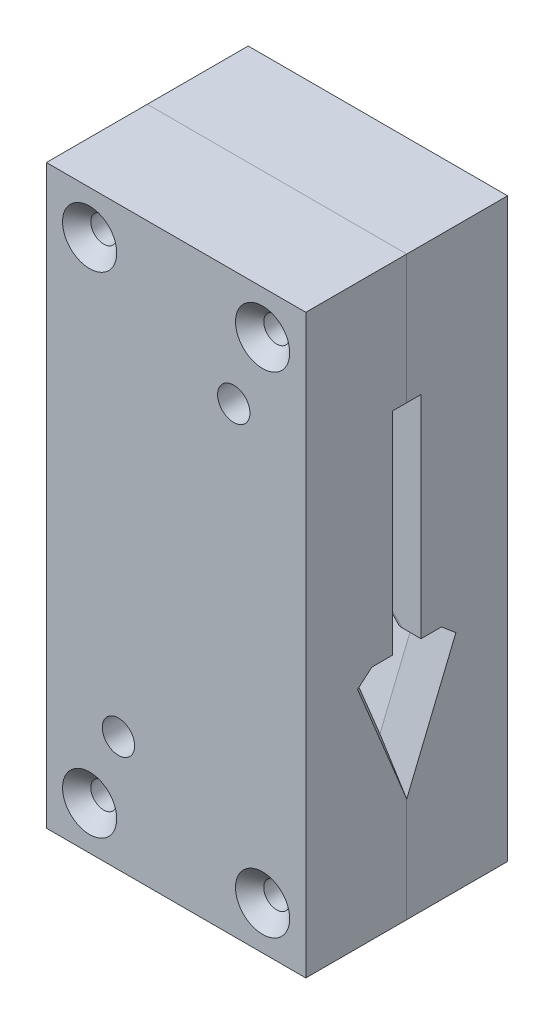
from build123d import *
from OCP.BRepFilletAPI import BRepFilletAPI_MakeChamfer

# Parameters (mm, degrees)
BOSS_V_BLADE_PROFILE_DEPTH                     = 150
CUT_BLADE_TIP_CHAMFER_DEPTH                    = 158.368393375
CUT_BLADE_TIP_CHAMFER_DEPTH_BACK               = 158.368393375
CHAMFER1_SIZE                                  = 1.8
CHAMFER1_SIZE2                                 = 5
FILLET1_R                                      = 15
SKETCH5_W                                      = 45
SKETCH5_H                                      = 100
BOSS_EXTRUDE_MAIN_BODY_DEPTH                   = 17.5
SKETCH7_W                                      = 45
SKETCH7_H                                      = 100
CUT_EXTRUDE_SPLIT_HALF_DEPTH                   = 93.589723794
CUT_EXTRUDE13_TRIANGLE_REACH                   = 90.86
CUT_EXTRUDE15_COMPLETE_ARROW_WITH_DRAFT_REACH  = 90.86
SKETCH23_R                                     = 2.8067
CUT_EXTRUDE12_THREADED_INSERTS_DEPTH           = 10
CHAMFER4_SIZE                                  = 5
CHAMFER4_SIZE2                                 = 1
FILLET2_R                                      = 1
SPLIT1_SURFACE_1_BACK                          = 116.109
SPLIT1_SURFACE_1_DEPTH                         = 232.218
SPLIT1_SURFACE_2_BACK                          = 116.109
SPLIT1_SURFACE_2_DEPTH                         = 232.218
CSK_FOR_M4_FLAT_HEAD_MACHINE_SCREW1_AT_2_COUNT = 2
CSK_FOR_M4_FLAT_HEAD_MACHINE_SCREW1_AT_2_PITCH = 30
CSK_FOR_M4_FLAT_HEAD_MACHINE_SCREW1_AT_3_COUNT = 2
CSK_FOR_M4_FLAT_HEAD_MACHINE_SCREW1_AT_3_PITCH = 85
CSK_FOR_M4_FLAT_HEAD_MACHINE_SCREW1_AT_4_COUNT = 2
CSK_FOR_M4_FLAT_HEAD_MACHINE_SCREW1_AT_4_PITCH = 90.138781887
F_1_0MM_START                                  = -17.5
F_1_0MM_DOWEL_HOLE1_OUTLINE_R                  = 2.807
F_1_0MM_DOWEL_HOLE1_DEPTH                      = 17.501


# Read off the part's stored shape, not the designer's step: Ø1.0mm Dowel Hole1
with BuildPart() as part:
    # Sketch3 → Boss-v blade profile (new body)
    with BuildSketch(Plane(origin=(0, 0, 0), x_dir=(0.7193398003386497, 0.6946583704589988, 0), z_dir=(0.6946583704589988, -0.7193398003386497, 0))):
        Polygon((13.036284021, -7.725), (0, 0), (13.036284021, 7.725), (14.030379125, 6.04741992), (3.82508674, 0), (14.030379125, -6.04741992), align=None)
    extrude(amount=BOSS_V_BLADE_PROFILE_DEPTH)

    # Sketch4 → Cut-blade tip chamfer (cut, two sides: drawn at the far end of the back side and taken through both)
    with BuildSketch(Plane.XY.offset(-CUT_BLADE_TIP_CHAMFER_DEPTH_BACK)):
        Polygon((10.092610118, 9.7463203), (0, 0), (2.611518653, -2.704306731), align=None)
    extrude(amount=CUT_BLADE_TIP_CHAMFER_DEPTH + CUT_BLADE_TIP_CHAMFER_DEPTH_BACK, mode=Mode.SUBTRACT)

    # Chamfer1
    chamfer1_edges = [part.edges().sort_by_distance(p)[0] for p in [
        (6.087035325, 3.079924357, -3.8625),
        (6.087035325, 3.079924357, 3.8625),
    ]]
    chamfer1_side = [part.faces().sort_by_distance(p)[0] for p in [
        (6.141291032, 3.170221016, -3.678457706),
    ]]
    chamfer(chamfer1_edges, length=CHAMFER1_SIZE, length2=CHAMFER1_SIZE2, reference=chamfer1_side[0])

    # Fillet1
    # the kernel refuses this fillet: 15 mm, written as the material it takes off along each edge
    with BuildSketch(Plane(origin=(128.043138255, -84.874717349, 26.213735463), x_dir=(-0.6188462152488227, -0.5976128433976327, 0.5097923609455172), z_dir=(-0.3667139351367172, -0.3541315307268587, -0.8602974768773856)), Plane(origin=(99.824500946, -112.125138638, 39.986155383), x_dir=(-0.6188462152488224, -0.5976128433976324, -0.5097923609455178), z_dir=(0.3667139351367176, 0.3541315307268591, -0.8602974768773851))) as fillet1_piece_1:
        with BuildLine():
            CenterArc((FILLET1_R, FILLET1_R), FILLET1_R, 180, 90)
            Line((0, FILLET1_R), (0, 0))
            Line((0, 0), (FILLET1_R, 0))
        make_face()
    extrude(amount=76.95, mode=Mode.SUBTRACT)


with BuildPart() as body_2:
    # Sketch5 → Boss-Extrude-main body (new, symmetric)
    with BuildSketch(Plane.XY):
        with Locations((29.477731109, -24.598407631)):
            Rectangle(SKETCH5_W, SKETCH5_H)
    extrude(amount=BOSS_EXTRUDE_MAIN_BODY_DEPTH, both=True)

    # Combine1: cut part
    add(part.part, mode=Mode.SUBTRACT)

    # Sketch7 → Cut-Extrude-split half (cut, through all)
    with BuildSketch(Plane.XY):
        with Locations((29.477731109, -24.598407631)):
            Rectangle(SKETCH7_W, SKETCH7_H)
    extrude(amount=-CUT_EXTRUDE_SPLIT_HALF_DEPTH, mode=Mode.SUBTRACT)

    # Sketch24 → Cut-Extrude13-triangle (cut, up to next)
    with BuildSketch(Plane(origin=(51.977731109, 0, 0), x_dir=(0, 0, -1), z_dir=(1, 0, 0)), mode=Mode.PRIVATE) as cut_extrude13_triangle_sk1:
        Polygon((-6.04741992, -33.626992184), (0, -33.626992184), (0, -48.318087575), align=None)
    cut_extrude13_triangle_tool1 = extrude(cut_extrude13_triangle_sk1.sketch, amount=-CUT_EXTRUDE13_TRIANGLE_REACH, mode=Mode.PRIVATE) & body_2.part
    add(cut_extrude13_triangle_tool1.solids().sort_by_distance((51.977731, -38.524024, 2.015807))[0], mode=Mode.SUBTRACT)

    # Cut-Extrude15-complete arrow with draft: up to this plane
    cut_extrude15_complete_arrow_with_draft_end = Plane(origin=(106.950292701, -105.243841529, 0), z_dir=(-0.36671393513671685, -0.3541315307268584, 0.8602974768773857))
    # Sketch25 → Cut-Extrude15-complete arrow with draft (cut, up to the surface)
    with BuildSketch(Plane(origin=(51.977731109, 0, 0), x_dir=(0, 0, -1), z_dir=(1, 0, 0)), mode=Mode.PRIVATE) as cut_extrude15_complete_arrow_with_draft_sk1:
        Polygon((-2.484190366, 3.062291075), (-2.484190366, -33.626992184), (-0.561386507, -33.626992184), (0, -33.626992184), (0, 3.062291075), align=None)
    cut_extrude15_complete_arrow_with_draft_tool1 = split(extrude(cut_extrude15_complete_arrow_with_draft_sk1.sketch, amount=-CUT_EXTRUDE15_COMPLETE_ARROW_WITH_DRAFT_REACH, mode=Mode.PRIVATE), bisect_by=cut_extrude15_complete_arrow_with_draft_end, keep=Keep.BOTH, mode=Mode.PRIVATE)
    add(cut_extrude15_complete_arrow_with_draft_tool1.solids().sort_by_distance((51.977731, -15.282351, 1.242095))[0], mode=Mode.SUBTRACT)

    # Sketch23 → Cut-Extrude12-threaded inserts (cut)
    with BuildSketch(Plane.XY.offset(17.5)):
        with Locations((39.477731109, 5.401592369)):
            Circle(SKETCH23_R)
        with Locations((19.477731109, -54.598407631)):
            Circle(SKETCH23_R)
    extrude(amount=-CUT_EXTRUDE12_THREADED_INSERTS_DEPTH, mode=Mode.SUBTRACT)

    # Mirror1: body 2 across plane


with BuildPart() as body_2_1:
    add(body_2.part)
    add(body_2.part.mirror(Plane.XY))

    # Chamfer4: one chamfer whose edges measure the first distance from different faces: ONE call of the kernel's chamfer builder (chamfer() names one face for all edges)
    chamfer4_edges_1 = [body_2_1.edges().sort_by_distance(p)[0] for p in [
        (51.977731109, -44.441282249, -3.8625),
    ]]
    chamfer4_side_1 = [body_2_1.faces().sort_by_distance(p)[0] for p in [
        (30.79332274, -22.751818401, -3.760564651),
    ]]
    chamfer4_edges_2 = [body_2_1.edges().sort_by_distance(p)[0] for p in [
        (51.977731109, -44.441282249, 3.8625),
    ]]
    chamfer4_side_2 = [body_2_1.faces().sort_by_distance(p)[0] for p in [
        (30.79332274, -22.751818401, 3.760564651),
    ]]
    chamfer4 = BRepFilletAPI_MakeChamfer(body_2_1.part.solid().wrapped)
    for e in chamfer4_edges_1:
        chamfer4.Add(CHAMFER4_SIZE, CHAMFER4_SIZE2, e.wrapped, chamfer4_side_1[0].wrapped)  # the first distance lies on this face
    for e in chamfer4_edges_2:
        chamfer4.Add(CHAMFER4_SIZE, CHAMFER4_SIZE2, e.wrapped, chamfer4_side_2[0].wrapped)  # the first distance lies on this face
    add(Compound.cast(chamfer4.Shape()), mode=Mode.REPLACE)

    # Fillet2
    fillet2_edges = [body_2_1.edges().sort_by_distance(p)[0] for p in [
        (7.582913517, 3.062291075, 2.226222828),
        (25.903310424, -15.282350554, 2.484190366),
        (7.582913517, 3.062291075, -2.226222828),
        (25.903310424, -15.282350554, -2.484190366),
    ]]
    fillet(fillet2_edges, radius=FILLET2_R)


with BuildPart() as body_2_2:
    # Split1: the piece behind the surface
    add(body_2_1.part)
    # Split1 surface: a surface, the sketch's curves swept straight by 232.218 mm
    with BuildLine(Plane(origin=(51.977731109, 0, 0), x_dir=(0, 0, -1), z_dir=(1, 0, 0)).offset(-SPLIT1_SURFACE_1_BACK), mode=Mode.PRIVATE) as split1_surface_1_path:
        Line((0, 25.401592369), (0, -74.598407631))
    split1_surface_1 = Shell.extrude(split1_surface_1_path.wire(), (1 * SPLIT1_SURFACE_1_DEPTH, 0 * SPLIT1_SURFACE_1_DEPTH, 0 * SPLIT1_SURFACE_1_DEPTH))
    split(bisect_by=split1_surface_1, keep=Keep.BOTTOM)

    # Sketch31 → CSK for M4 Flat Head Machine Screw1 (revolve, cut)
    with BuildSketch(Plane(origin=(14.477731109, 17.901592369, 17.5), x_dir=(0, -1, 0), z_dir=(1, 0, 0))):
        Polygon((0, 0), (0, 17.5), (2.25, 17.5), (2.25, 2.45), (4.7, 0), align=None)
    csk_for_m4_flat_head_machine_screw1 = revolve(axis=Axis((14.477731109, 17.901592369, 23.85), (0, 0, -1)), mode=Mode.SUBTRACT)

    # CSK for M4 Flat Head Machine Screw1 at 2: CSK for M4 Flat Head Machine Screw1 ×2
    with Locations(*[(i * CSK_FOR_M4_FLAT_HEAD_MACHINE_SCREW1_AT_2_PITCH, 0, 0) for i in range(1, CSK_FOR_M4_FLAT_HEAD_MACHINE_SCREW1_AT_2_COUNT)]):
        add(csk_for_m4_flat_head_machine_screw1, mode=Mode.SUBTRACT)

    # CSK for M4 Flat Head Machine Screw1 at 3: CSK for M4 Flat Head Machine Screw1 ×2
    with Locations(*[(0, -i * CSK_FOR_M4_FLAT_HEAD_MACHINE_SCREW1_AT_3_PITCH, 0) for i in range(1, CSK_FOR_M4_FLAT_HEAD_MACHINE_SCREW1_AT_3_COUNT)]):
        add(csk_for_m4_flat_head_machine_screw1, mode=Mode.SUBTRACT)

    # CSK for M4 Flat Head Machine Screw1 at 4: CSK for M4 Flat Head Machine Screw1 ×2
    with Locations(*[Vector(0.33282011773513764, -0.9429903335828895, 0) * (i * CSK_FOR_M4_FLAT_HEAD_MACHINE_SCREW1_AT_4_PITCH) for i in range(1, CSK_FOR_M4_FLAT_HEAD_MACHINE_SCREW1_AT_4_COUNT)]):
        add(csk_for_m4_flat_head_machine_screw1, mode=Mode.SUBTRACT)


with BuildPart() as body_2_3:
    add(body_2_1.part)

    # Split1: split by a surface, the side it looks to stays
    # Split1 surface: a surface, the sketch's curves swept straight by 232.218 mm
    with BuildLine(Plane(origin=(51.977731109, 0, 0), x_dir=(0, 0, -1), z_dir=(1, 0, 0)).offset(-SPLIT1_SURFACE_2_BACK), mode=Mode.PRIVATE) as split1_surface_2_path:
        Line((0, 25.401592369), (0, -74.598407631))
    split1_surface_2 = Shell.extrude(split1_surface_2_path.wire(), (1 * SPLIT1_SURFACE_2_DEPTH, 0 * SPLIT1_SURFACE_2_DEPTH, 0 * SPLIT1_SURFACE_2_DEPTH))
    split(bisect_by=split1_surface_2, keep=Keep.TOP)


with BuildPart() as f_1_0mm_dowel_hole1_tool:
    # Ø1.0mm Dowel Hole1 outline → Ø1.0mm Dowel Hole1 (new body)
    with BuildSketch(Plane.XY.offset(F_1_0MM_START)):
        with Locations((44.477731109, 17.901592369)):
            Circle(F_1_0MM_DOWEL_HOLE1_OUTLINE_R)
        with Locations((14.477731109, 17.901592369)):
            Circle(F_1_0MM_DOWEL_HOLE1_OUTLINE_R)
        with Locations((14.477731109, -67.098407631)):
            Circle(F_1_0MM_DOWEL_HOLE1_OUTLINE_R)
        with Locations((44.477731109, -67.098407631)):
            Circle(F_1_0MM_DOWEL_HOLE1_OUTLINE_R)
    extrude(amount=F_1_0MM_DOWEL_HOLE1_DEPTH)


with BuildPart() as body_2_4:
    add(body_2_3.part)

    # Ø1.0mm Dowel Hole1: cut by f_1_0mm_dowel_hole1_tool
    add(f_1_0mm_dowel_hole1_tool.part, mode=Mode.SUBTRACT)


with BuildPart() as body_2_2_1:
    add(body_2_2.part)

    # Ø1.0mm Dowel Hole1: cut by f_1_0mm_dowel_hole1_tool
    add(f_1_0mm_dowel_hole1_tool.part, mode=Mode.SUBTRACT)


solid = Compound([body_2_4.part, body_2_2_1.part])
